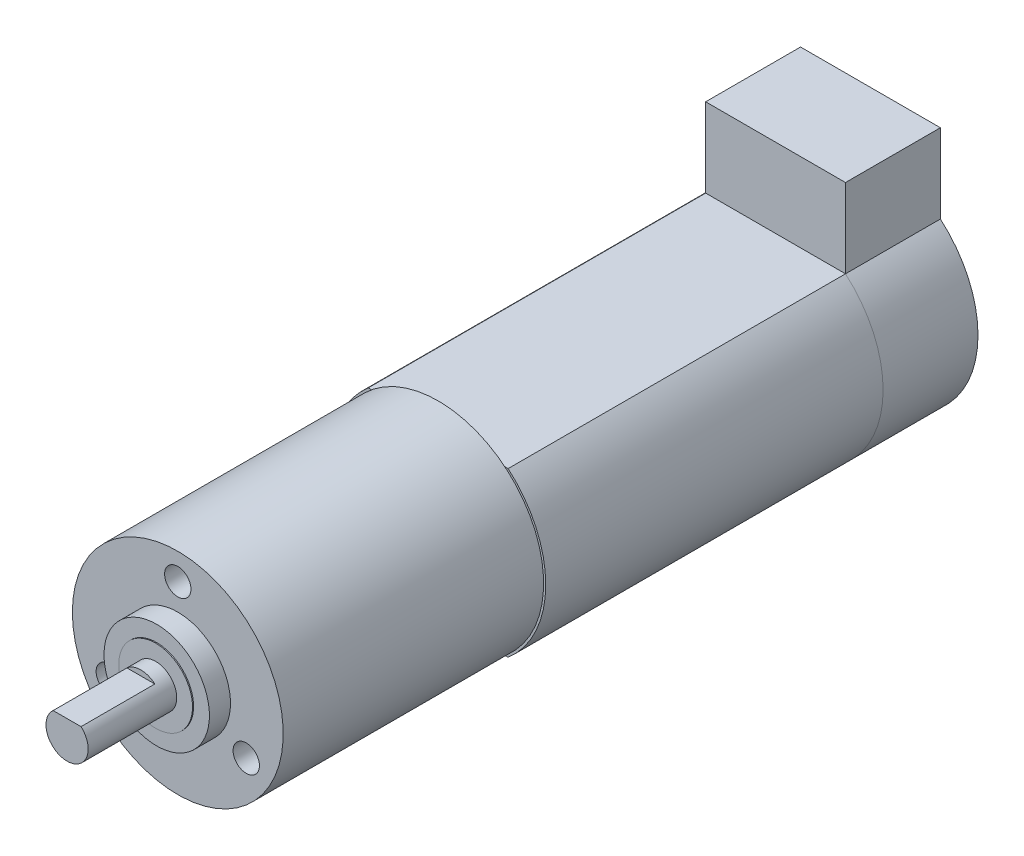
from build123d import *

# Parameters (mm, degrees)
BOSS_EXTRUDE1_DEPTH = 7
SKETCH2_R           = 2
BOSS_EXTRUDE2_DEPTH = 1.4
SKETCH3_R           = 3.5
BOSS_EXTRUDE3_DEPTH = 0.1
SKETCH4_R           = 5
BOSS_EXTRUDE4_DEPTH = 2
SKETCH5_R           = 10
BOSS_EXTRUDE5_DEPTH = 24.7
SKETCH6_R           = 1.25
SCREW_HOLES_DEPTH   = 5
MOTOR_DEPTH         = 32
ENCODER_DEPTH       = 9


with BuildPart() as part:
    # Sketch1 → Boss-Extrude1 (new body)
    with BuildSketch(Plane.XY):
        with BuildLine():
            Line((-1.322875656, 1.5), (1.322875656, 1.5))
            ThreePointArc((1.322875656, 1.5), (0, -2), (-1.322875656, 1.5))
        make_face()
    extrude(amount=-BOSS_EXTRUDE1_DEPTH)

    # Sketch2 → Boss-Extrude2 (add)
    with BuildSketch(Plane(origin=(0, 0, -7), x_dir=(-1, 0, 0), z_dir=(0, 0, -1))):
        Circle(SKETCH2_R)
    extrude(amount=BOSS_EXTRUDE2_DEPTH)

    # Sketch3 → Boss-Extrude3 (add)
    with BuildSketch(Plane(origin=(0, 0, -8.4), x_dir=(-1, 0, 0), z_dir=(0, 0, -1))):
        Circle(SKETCH3_R)
    extrude(amount=BOSS_EXTRUDE3_DEPTH)


with BuildPart() as body_2:
    # Sketch4 → Boss-Extrude4 (new body)
    with BuildSketch(Plane(origin=(0, 0, -8.5), x_dir=(-1, 0, 0), z_dir=(0, 0, -1))):
        Circle(SKETCH4_R)
    extrude(amount=BOSS_EXTRUDE4_DEPTH)

    # Sketch5 → Boss-Extrude5 (add)
    with BuildSketch(Plane(origin=(0, 0, -10.5), x_dir=(-1, 0, 0), z_dir=(0, 0, -1))):
        Circle(SKETCH5_R)
    extrude(amount=BOSS_EXTRUDE5_DEPTH)

    # Sketch6 → Screw Holes (cut)
    with BuildSketch(Plane.XY.offset(-10.5)):
        with Locations((0, 7.5)):
            Circle(SKETCH6_R)
        with Locations((6.495190528, -3.75)):
            Circle(SKETCH6_R)
        with Locations((-6.495190528, -3.75)):
            Circle(SKETCH6_R)
    extrude(amount=-SCREW_HOLES_DEPTH, mode=Mode.SUBTRACT)


with BuildPart() as body_3:
    # Sketch10 → Motor (new body)
    with BuildSketch(Plane(origin=(0, 0, -35.2), x_dir=(-1, 0, 0), z_dir=(0, 0, -1))):
        with BuildLine():
            Line((-6.631553363, 7.75), (6.631553363, 7.75))
            ThreePointArc((6.631553363, 7.75), (10.2, 0), (6.631553363, -7.75))
            Line((6.631553363, -7.75), (-6.631553363, -7.75))
            ThreePointArc((-6.631553363, -7.75), (-10.2, 0), (-6.631553363, 7.75))
        make_face()
    extrude(amount=MOTOR_DEPTH)


with BuildPart() as body_4:
    # Sketch11 → Encoder (new body)
    with BuildSketch(Plane(origin=(0, 0, -67.2), x_dir=(-1, 0, 0), z_dir=(0, 0, -1))):
        with BuildLine():
            Line((-6.631553363, -7.75), (6.631553363, -7.75))
            ThreePointArc((6.631553363, -7.75), (10.2, 0), (6.631553363, 7.75))
            Line((6.631553363, 7.75), (6.631553363, 15.25))
            Line((6.631553363, 15.25), (-6.631553363, 15.25))
            Line((-6.631553363, 15.25), (-6.631553363, 7.75))
            ThreePointArc((-6.631553363, 7.75), (-10.2, 0), (-6.631553363, -7.75))
        make_face()
    extrude(amount=ENCODER_DEPTH)


solid = Compound([part.part, body_2.part, body_3.part, body_4.part])
